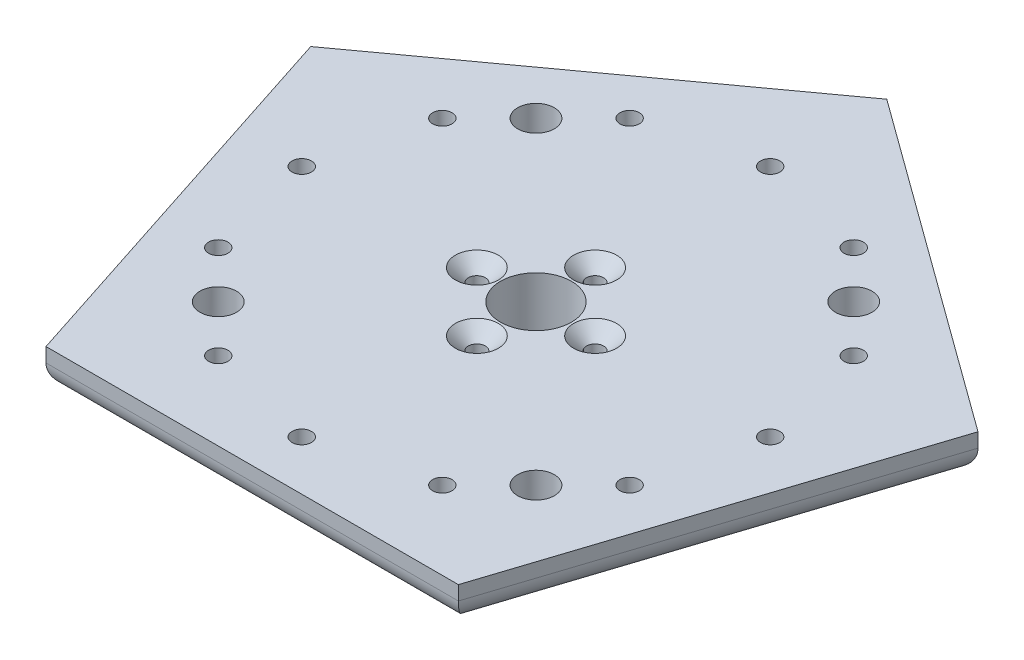
from build123d import *

# Parameters (mm, degrees)
BOSS_EXTRUDE1_DEPTH                                 = 8
SKETCH2_R                                           = 3.875
SKETCH2_R_2                                         = 2.05
CUT_EXTRUDE1_DEPTH                                  = 103.661522502
CIRPATTERN1_COUNT                                   = 4
SKETCH4_R                                           = 34.5
SKETCH4_R_2                                         = 30.5
BOSS_EXTRUDE2_DEPTH                                 = 12.5
SKETCH5_R                                           = 20
BOSS_EXTRUDE3_DEPTH                                 = 1
SKETCH6_R                                           = 17.5
BOSS_EXTRUDE4_DEPTH                                 = 18
SKETCH7_R                                           = 7.5
CUT_EXTRUDE2_DEPTH                                  = 106.85078272
SKETCH9_R                                           = 3.975
BOSS_EXTRUDE6_DEPTH                                 = 2
SKETCH10_R                                          = 4.975
BOSS_EXTRUDE7_DEPTH                                 = 3
CHAMFER2_START                                      = -3.006253442
CHAMFER2_DEPTH                                      = 0.006253442
CHAMFER2_START_2                                    = -7.5000001
CHAMFER2_2_DEPTH                                    = 4.493746658
CHAMFER2_3_ANGLE                                    = 16.582247
CIRPATTERN2_COUNT                                   = 4
CSK_FOR_M4_COUNTERSUNK_FLAT_HEAD_SCREW1_D           = 3.6
CSK_FOR_M4_COUNTERSUNK_FLAT_HEAD_SCREW1_CSINK_D     = 9.1
CSK_FOR_M4_COUNTERSUNK_FLAT_HEAD_SCREW1_CSINK_ANGLE = 90
BOSS_EXTRUDE8_DEPTH                                 = 12.5
FILLET1_R                                           = 5


with BuildPart() as part:
    # Sketch1 → Boss-Extrude1 (new body)
    with BuildSketch(Plane(origin=(0, 0, 0), x_dir=(1, 0, 0), z_dir=(0, 1, 0))):
        Polygon((0, 74.16407865), (-70.534230275, 22.917960675), (-43.59255168, -60), (43.59255168, -60), (70.534230275, 22.917960675), align=None)
    extrude(amount=BOSS_EXTRUDE1_DEPTH)

    # Sketch2 → Cut-Extrude1 (cut, through all)
    with BuildSketch(Plane(origin=(0, 8, 0), x_dir=(1, 0, 0), z_dir=(0, 1, 0))):
        with Locations(Location((-33.587572106, -33.587572106, 0), (0, 0, 270))):
            Circle(SKETCH2_R)
        with Locations(Location((-43.487067043, -23.68807717, 0), (0, 0, 270))):
            Circle(SKETCH2_R_2)
        with Locations(Location((-23.68807717, -43.487067043, 0), (0, 0, 270))):
            Circle(SKETCH2_R_2)
        with Locations(Location((0, -49.52, 0), (0, 0, 270))):
            Circle(SKETCH2_R_2)
    cut_extrude1 = extrude(amount=-CUT_EXTRUDE1_DEPTH, mode=Mode.SUBTRACT)

    # CirPattern1: Cut-Extrude1 ×4 about axis
    cirpattern1_axis = Axis((0, 0, 0), (0, 1, 0))
    for i in range(1, CIRPATTERN1_COUNT):
        add(cut_extrude1.rotate(cirpattern1_axis, i * 360 / CIRPATTERN1_COUNT), mode=Mode.SUBTRACT)

    # Sketch4 → Boss-Extrude2 (add)
    with BuildSketch(Plane.XZ):
        with Locations(Location((0, 0, 0), (0, 0, 90))):
            Circle(SKETCH4_R)
        with Locations(Location((0, 0, 0), (0, 0, 270))):
            Circle(SKETCH4_R_2, mode=Mode.SUBTRACT)
    extrude(amount=BOSS_EXTRUDE2_DEPTH)

    # Sketch5 → Boss-Extrude3 (add)
    with BuildSketch(Plane.XZ):
        with Locations(Location((0, 0, 0), (0, 0, 90))):
            Circle(SKETCH5_R)
    extrude(amount=BOSS_EXTRUDE3_DEPTH)

    # Sketch6 → Boss-Extrude4 (add)
    with BuildSketch(Plane.XZ.offset(1)):
        with Locations(Location((0, 0, 0), (0, 0, 270))):
            Circle(SKETCH6_R)
    extrude(amount=BOSS_EXTRUDE4_DEPTH)

    # Sketch7 → Cut-Extrude2 (cut, through all)
    with BuildSketch(Plane.XZ.offset(19)):
        with Locations(Location((0, 0, 0), (0, 0, 270))):
            Circle(SKETCH7_R)
    extrude(amount=-CUT_EXTRUDE2_DEPTH, mode=Mode.SUBTRACT)

    # Sketch9 → Boss-Extrude6 (add)
    with BuildSketch(Plane.XZ):
        with Locations((33.587572106, -33.587572106)):
            Circle(SKETCH9_R)
        with Locations((-33.587572106, -33.587572106)):
            Circle(SKETCH9_R)
        with Locations((-33.587572106, 33.587572106)):
            Circle(SKETCH9_R)
        with Locations((33.587572106, 33.587572106)):
            Circle(SKETCH9_R)
    extrude(amount=-BOSS_EXTRUDE6_DEPTH)

    # Sketch10 → Boss-Extrude7 (add)
    with BuildSketch(Plane.XZ):
        with BuildLine():
            Line((20.6223527, -27.658065173), (30.06971587, -37.105428343))
            ThreePointArc((30.06971587, -37.105428343), (30.06971587, -30.06971587), (37.105428343, -30.06971587))
            Line((37.105428343, -30.06971587), (27.658065173, -20.6223527))
            ThreePointArc((27.658065173, -20.6223527), (24.395183951, -24.395183951), (20.6223527, -27.658065173))
        make_face()
        with Locations((33.587572106, -33.587572106)):
            Circle(SKETCH10_R)
    boss_extrude7 = extrude(amount=BOSS_EXTRUDE7_DEPTH)

    # Chamfer2: read off the stored shape, not the designer's step
    # Chamfer2 outline → Chamfer2 (add)
    with BuildSketch(Plane(origin=(0, 0, 0), x_dir=(1, 0, 0), z_dir=(0, 1, 0)).offset(CHAMFER2_START)):
        with BuildLine():
            ThreePointArc((37.105428343, 30.06971587), (37.105428343, 37.105428343), (30.06971587, 37.105428343))
            Line((30.06971587, 37.105428343), (20.6223527, 27.658065173))
            ThreePointArc((20.6223527, 27.658065173), (24.395183951, 24.395183951), (27.658065173, 20.6223527))
            Line((27.658065173, 20.6223527), (37.105428343, 30.06971587))
        make_face()
    chamfer2 = extrude(amount=CHAMFER2_DEPTH)

    # Chamfer2 2 outline → Chamfer2 2 (add)
    with BuildSketch(Plane(origin=(0, 0, 0), x_dir=(1, 0, 0), z_dir=(0, 1, 0)).offset(CHAMFER2_START_2)):
        with BuildLine():
            ThreePointArc((37.105428343, 30.06971587), (37.105428343, 37.105428343), (30.06971587, 37.105428343))
            Line((30.06971587, 37.105428343), (20.6223527, 27.658065173))
            ThreePointArc((20.6223527, 27.658065173), (24.395183951, 24.395183951), (27.658065173, 20.6223527))
            Line((27.658065173, 20.6223527), (37.105428343, 30.06971587))
        make_face()
    chamfer2_2 = extrude(amount=CHAMFER2_2_DEPTH)

    # Chamfer2 3 outline → Chamfer2 3 (revolve, cut)
    with BuildSketch(Plane(origin=(0, 0, 0), x_dir=(0.801683048491221, 0, -0.597749353627273), z_dir=(0.597749353627273, 0, 0.801683048491221))):
        Polygon((52.475017897, -3.006245526), (34.5, -7.5), (52.475, -7.5000001), align=None)
    chamfer2_3 = revolve(axis=Axis((0, 0, 0), (0, 1, 0)), revolution_arc=CHAMFER2_3_ANGLE, mode=Mode.SUBTRACT)

    # CirPattern2: Boss-Extrude7, Chamfer2, Chamfer2 2, Chamfer2 3 ×4 about axis
    cirpattern2_axis = Axis((0, 0, 0), (0, 1, 0))
    add([boss_extrude7.rotate(cirpattern2_axis, i * 360 / CIRPATTERN2_COUNT) for i in range(1, CIRPATTERN2_COUNT)])
    add([chamfer2.rotate(cirpattern2_axis, i * 360 / CIRPATTERN2_COUNT) for i in range(1, CIRPATTERN2_COUNT)])
    add([chamfer2_2.rotate(cirpattern2_axis, i * 360 / CIRPATTERN2_COUNT) for i in range(1, CIRPATTERN2_COUNT)])
    add([chamfer2_3.rotate(cirpattern2_axis, i * 360 / CIRPATTERN2_COUNT) for i in range(1, CIRPATTERN2_COUNT)], mode=Mode.SUBTRACT)

    # CSK for M4 Countersunk Flat Head Screw1 (through all)
    with Locations(Plane(origin=(0, 8, -12.5), x_dir=(0, 0, 1), z_dir=(0, 1, 0))):
        with Locations((0, 0), (12.5, 12.5), (25, 0), (12.5, -12.5)):
            CounterSinkHole(CSK_FOR_M4_COUNTERSUNK_FLAT_HEAD_SCREW1_D / 2, CSK_FOR_M4_COUNTERSUNK_FLAT_HEAD_SCREW1_CSINK_D / 2, counter_sink_angle=CSK_FOR_M4_COUNTERSUNK_FLAT_HEAD_SCREW1_CSINK_ANGLE)

    # Sketch13 → Boss-Extrude8 (add)
    with BuildSketch(Plane.XZ):
        with BuildLine():
            Line((-11.79321147, -32.421754475), (-12.732901193, -35.928724264))
            ThreePointArc((-12.732901193, -35.928724264), (-10.611580849, -39.602958878), (-6.937346235, -37.481638534))
            Line((-6.937346235, -37.481638534), (-5.997656512, -33.974668745))
            ThreePointArc((-5.997656512, -33.974668745), (-8.929257056, -33.324441007), (-11.79321147, -32.421754475))
        make_face()
    extrude(amount=BOSS_EXTRUDE8_DEPTH)

    # Fillet1
    fillet1_edges = [part.edges().sort_by_distance(p)[0] for p in [
        (57.063390978, 0, 18.541019662),
        (0, 0, 60),
        (-57.063390978, 0, 18.541019662),
        (-35.267115138, 0, -48.541019662),
        (35.267115138, 0, -48.541019662),
    ]]
    fillet(fillet1_edges, radius=FILLET1_R)


solid = part.part
